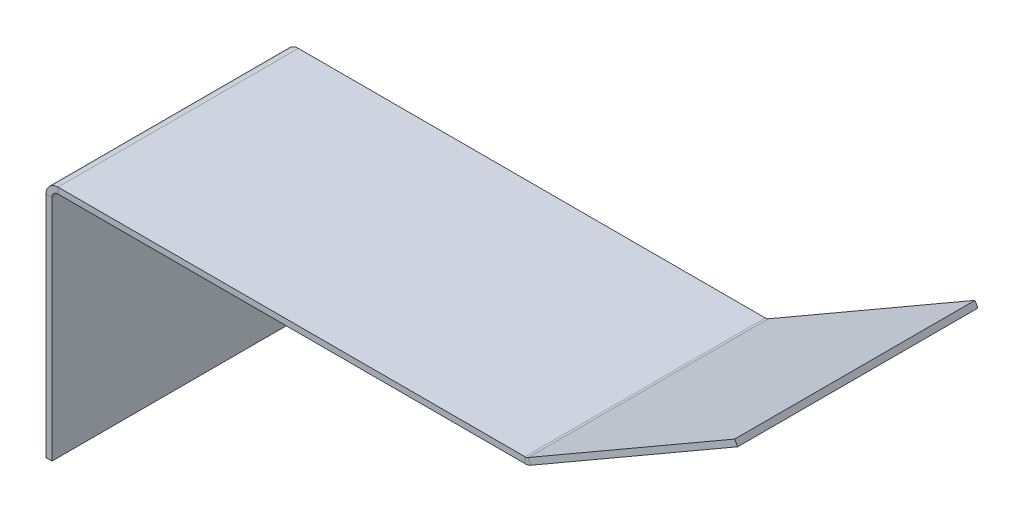
from build123d import *

# Parameters (mm, degrees)
BASE_FLANGE1_DEPTH = 127


# Sheet-metal steps are written as plain solids
with BuildPart() as part:
    # Sketch2 → Base-Flange1 (new body)
    with BuildSketch(Plane.XY):
        with BuildLine():
            Line((0, 0), (0, 120.65))
            ThreePointArc((0, 120.65), (1.859871939, 125.140128061), (6.35, 127))
            Line((6.35, 127), (253.149261314, 127))
            ThreePointArc((253.149261314, 127), (253.971011782, 127.108185502), (254.736761314, 127.425369343))
            Line((254.736761314, 127.425369343), (363.985226281, 190.5))
            Line((363.985226281, 190.5), (365.572726281, 187.750369343))
            Line((365.572726281, 187.750369343), (256.324261314, 124.675738686))
            ThreePointArc((256.324261314, 124.675738686), (254.79276225, 124.041371003), (253.149261314, 123.825))
            Line((253.149261314, 123.825), (6.35, 123.825))
            ThreePointArc((6.35, 123.825), (4.10493597, 122.89506403), (3.175, 120.65))
            Line((3.175, 120.65), (3.175, 0))
            Line((3.175, 0), (0, 0))
        make_face()
    extrude(amount=BASE_FLANGE1_DEPTH)


solid = part.part
